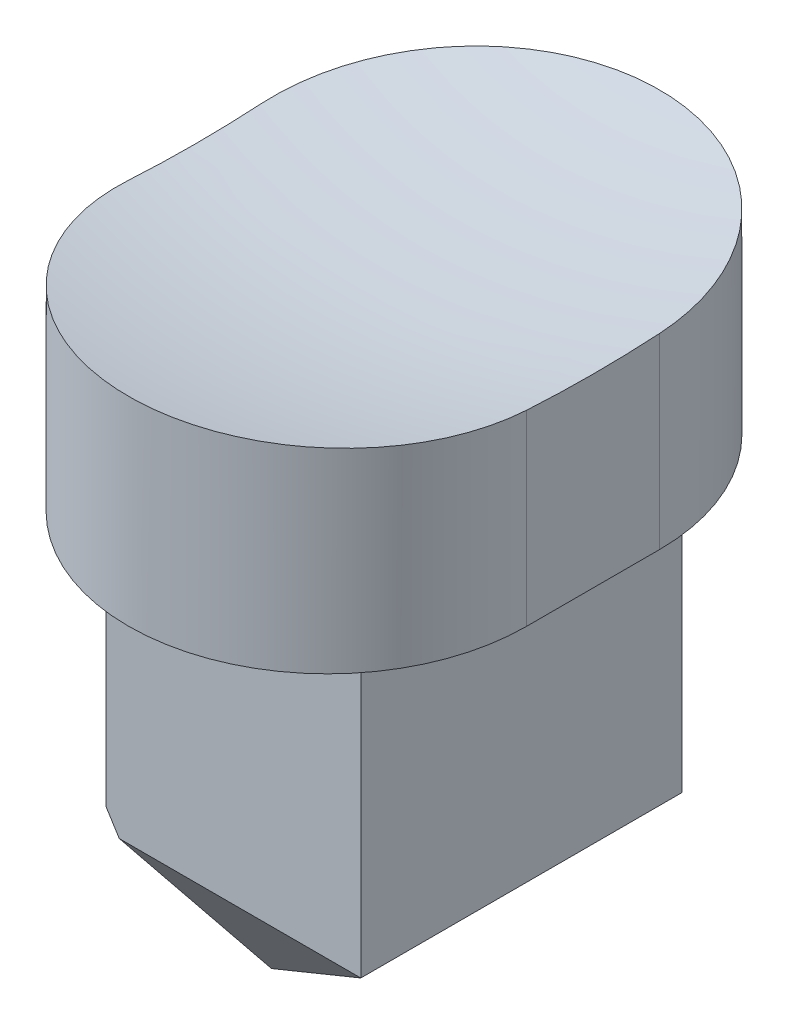
from build123d import *

# Parameters (mm, degrees)
SKETCH1_W               = 19.2
SKETCH1_H               = 24.2
BOSS_EXTRUDE1_DEPTH     = 22.1
BOSS_EXTRUDE2_DEPTH     = 15
BOSS_EXTRUDE3_DEPTH     = 5
BOSS_EXTRUDE4_DEPTH     = 1.5
FILLET1_R               = 3
SKETCH9_W               = 19.8
SKETCH9_H               = 24.8
SKETCH9_W_2             = 19.2
SKETCH9_H_2             = 24.2
CUT_EXTRUDE_THIN1_DEPTH = 10
SKETCH10_W              = 24.8
SKETCH10_H              = 0.3
CUT_EXTRUDE1_DEPTH      = 19.2
SKETCH12_W              = 19.8
SKETCH12_H              = 24.8
CUT_EXTRUDE3_DEPTH      = 0.3
SKETCH13_W              = 24.2
SKETCH13_H              = 15
CUT_EXTRUDE4_DEPTH      = 49.801332116
CHAMFER1_SIZE           = 0.75
CHAMFER2_SIZE           = 0.75
BOSS_EXTRUDE5_DEPTH     = 24.2
CUT_EXTRUDE5_DEPTH      = 19.2
CHAMFER3_SIZE           = 1


with BuildPart() as part:
    # Sketch1 → Boss-Extrude1 (new body)
    with BuildSketch(Plane(origin=(0, 0, 0), x_dir=(1, 0, 0), z_dir=(0, 1, 0))):
        Rectangle(SKETCH1_W, SKETCH1_H)
    extrude(amount=BOSS_EXTRUDE1_DEPTH)

    # Sketch2 → Boss-Extrude2 (add)
    with BuildSketch(Plane(origin=(0, 22.1, 0), x_dir=(1, 0, 0), z_dir=(0, 1, 0))):
        with BuildLine():
            Line((15, 5), (15, -5))
            ThreePointArc((15, -5), (0, -20), (-15, -5))
            Line((-15, -5), (-15, 5))
            ThreePointArc((-15, 5), (0, 20), (15, 5))
        make_face()
    extrude(amount=BOSS_EXTRUDE2_DEPTH)

    # Sketch4 → Boss-Extrude3 (add)
    with BuildSketch(Plane.ZY.offset(9.6)):
        Polygon((-12.1, 0), (0, -15), (12.1, 0), align=None)
    extrude(amount=-BOSS_EXTRUDE3_DEPTH)

    # Sketch6 → Boss-Extrude4 (add, symmetric)
    with BuildSketch(Plane.XY):
        Polygon((-4.6, -5), (9.6, 0), (-4.6, 0), align=None)
    extrude(amount=BOSS_EXTRUDE4_DEPTH, both=True)

    # Fillet1
    fillet1_edges = [part.edges().sort_by_distance(p)[0] for p in [
        (-4.6, 0, 6.8),
        (-4.6, 0, -6.8),
    ]]
    fillet(fillet1_edges, radius=FILLET1_R)

    # Sketch8 → Cut-Revolve3 (revolve, cut)
    with BuildSketch(Plane(origin=(0, 0, 0), x_dir=(0, 0, -1), z_dir=(1, 0, 0))):
        with BuildLine():
            Line((-85.278426346, 120), (85.278426346, 120))
            ThreePointArc((85.278426346, 120), (0, 34.721573654), (-85.278426346, 120))
        make_face()
    revolve(axis=Axis((0, 120, 85.278426346), (0, 0, -1)), mode=Mode.SUBTRACT)

    # Sketch9 → Cut-Extrude-Thin1 (cut)
    with BuildSketch(Plane.XZ.offset(-22.1)):
        Rectangle(SKETCH9_W, SKETCH9_H)
        Rectangle(SKETCH9_W_2, SKETCH9_H_2, mode=Mode.SUBTRACT)
    extrude(amount=-CUT_EXTRUDE_THIN1_DEPTH, mode=Mode.SUBTRACT)

    # Sketch10 → Cut-Extrude1 (cut)
    with BuildSketch(Plane.ZY.offset(9.6)):
        with Locations((0, 32.25)):
            Rectangle(SKETCH10_W, SKETCH10_H)
    extrude(amount=-CUT_EXTRUDE1_DEPTH, mode=Mode.SUBTRACT)


with BuildPart() as cut_extrude1_piece_1:
    # of the separate pieces the step leaves, piece 1, a body of its own (cut_extrude1_pieces)
    add(part.part.solids().sort_by_distance((-1.6, 0, -12.1))[0])

    # Sketch13 → Cut-Extrude4 (cut, through all)
    with BuildSketch(Plane(origin=(9.6, 0, 0), x_dir=(0, 0, -1), z_dir=(1, 0, 0))):
        with Locations((0, -7.5)):
            Rectangle(SKETCH13_W, SKETCH13_H)
    extrude(amount=-CUT_EXTRUDE4_DEPTH, mode=Mode.SUBTRACT)

    # Chamfer2
    chamfer2_edges = [cut_extrude1_piece_1.edges().sort_by_distance(p)[0] for p in [
        (0, 32.1, -12.1),
        (9.6, 32.1, 0),
        (0, 32.1, 12.1),
        (-9.6, 32.1, 0),
    ]]
    chamfer(chamfer2_edges, length=CHAMFER2_SIZE)

    # Sketch19 → Boss-Extrude5 (add)
    with BuildSketch(Plane(origin=(0, 0, -12.1), x_dir=(-1, 0, 0), z_dir=(0, 0, -1))):
        Polygon((-9.6, 0), (9.6, 0), (9.6, -15), align=None)
    extrude(amount=-BOSS_EXTRUDE5_DEPTH)

    # Sketch20 → Cut-Extrude5 (cut)
    with BuildSketch(Plane(origin=(9.6, 0, 0), x_dir=(0, 0, -1), z_dir=(1, 0, 0))):
        Polygon((0, -15), (-12.1, 0), (-12.1, -15), align=None)
        Polygon((12.1, 0), (0, -15), (12.1, -15), align=None)
    extrude(amount=-CUT_EXTRUDE5_DEPTH, mode=Mode.SUBTRACT)

    # Chamfer3
    # the kernel refuses this chamfer: 1 mm, written as the material it takes off along each edge
    with BuildSketch(Plane(origin=(-9.6, -17.001621212, -1.614641111), x_dir=(-0.02749587661058568, 0.6276164868252807, -0.778036967138778), z_dir=(0, 0.7783312410184164, 0.6278538677548557)), Plane(origin=(-9.6, 2.001621212, -13.714641111), x_dir=(-0.0274958766105857, 0.6276164868252808, 0.7780369671387779), z_dir=(0, -0.7783312410184163, 0.6278538677548559))) as chamfer3_piece_1:
        Polygon((CHAMFER3_SIZE * 0.999621916911, -CHAMFER3_SIZE * 0.0274958766106), (-CHAMFER3_SIZE * 0.0274958766106, -CHAMFER3_SIZE * 0.999621916911), (0, 0), align=None)
    extrude(amount=24.415366391, mode=Mode.SUBTRACT)


with BuildPart() as cut_extrude1_piece_2:
    # of the separate pieces the step leaves, piece 2, a body of its own (cut_extrude1_pieces)
    add(part.part.solids().sort_by_distance((-9.6, 32.1, -12.4))[0])

    # Sketch12 → Cut-Extrude3 (cut)
    with BuildSketch(Plane.XZ.offset(-32.1)):
        Rectangle(SKETCH12_W, SKETCH12_H)
    extrude(amount=-CUT_EXTRUDE3_DEPTH, mode=Mode.SUBTRACT)

    # Chamfer1
    chamfer1_edges = [cut_extrude1_piece_2.edges().sort_by_distance(p)[0] for p in [
        (9.9, 22.1, 0),
        (0, 22.1, -12.4),
        (-9.9, 22.1, 0),
        (0, 22.1, 12.4),
    ]]
    chamfer(chamfer1_edges, length=CHAMFER1_SIZE)


solid = Compound([cut_extrude1_piece_1.part, cut_extrude1_piece_2.part])
